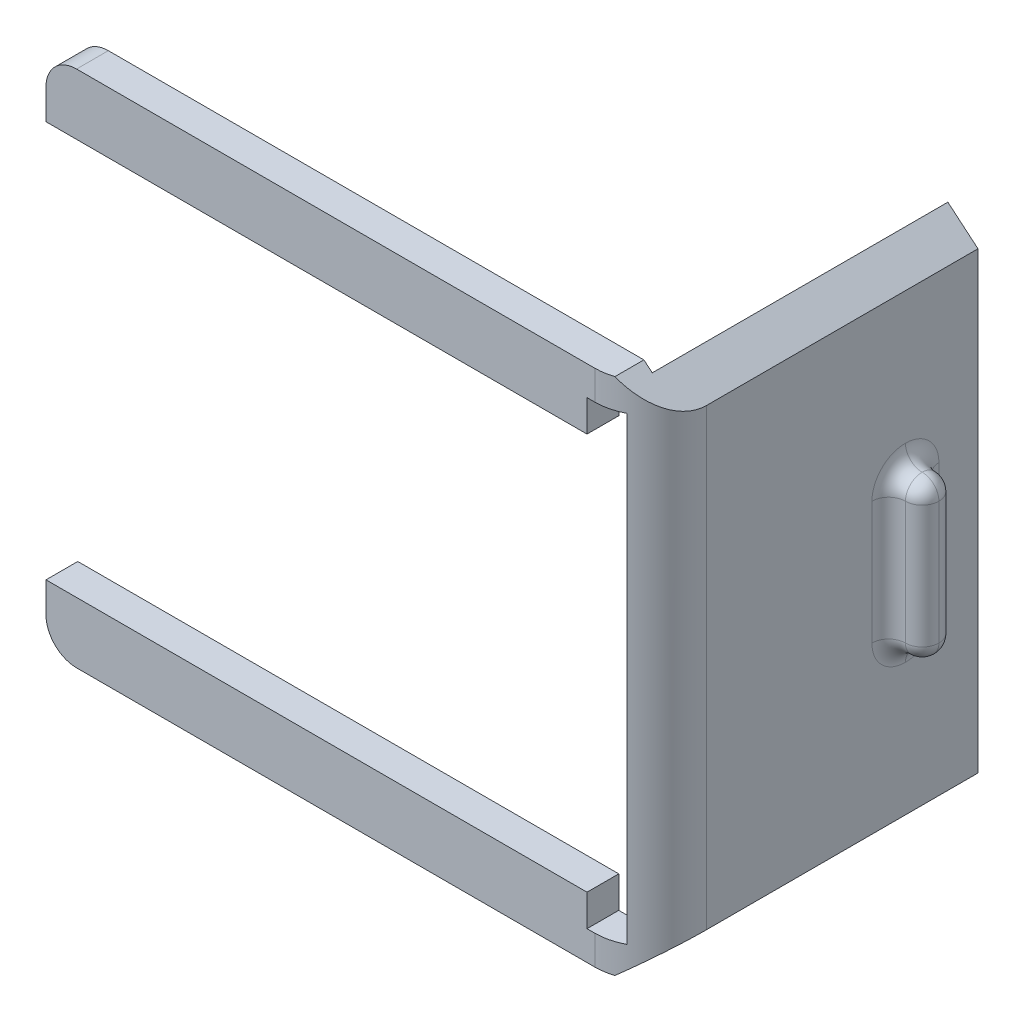
from build123d import *

# Parameters (mm, degrees)
BOSS_EXTRUDE1_DEPTH = 29.3184
BOSS_EXTRUDE2_DEPTH = 2.8448
FILLET1_R           = 5
SKETCH3_W           = 3
SKETCH3_H           = 14
BOSS_EXTRUDE3_DEPTH = 3
FILLET2_R           = 1.5
FILLET3_R           = 1.5


# Some blends are built 0.0001 mm under size
with BuildPart() as part:
    # Sketch1 → Boss-Extrude1 (new body)
    with BuildSketch(Plane.XY):
        Polygon((33.95, 21.346198616), (33.95, -23.846198616), (36.648979486, -21.581485925), (36.648979486, -1.25), (36.648979486, 19.081485925), align=None)
    extrude(amount=BOSS_EXTRUDE1_DEPTH)

    # Sketch2 → Boss-Extrude2 (add)
    with BuildSketch(Plane.XY.offset(29.3184)):
        with BuildLine():
            Line((33.95, -21.846198616), (33.95, -23.846198616))
            Line((33.95, -23.846198616), (33.200504516, -24.4751))
            Line((33.200504516, -24.4751), (-14.764, -24.4751))
            ThreePointArc((-14.764, -24.4751), (-16.701369719, -23.67255493), (-17.503709057, -21.7351))
            Line((-17.503709057, -21.7351), (-17.503709057, -19.0141))
            Line((-17.503709057, -19.0141), (30.95, -19.0141))
            Line((30.95, -19.0141), (30.95, -21.846198616))
            Line((30.95, -21.846198616), (33.95, -21.846198616))
        make_face()
        with BuildLine():
            Line((30.95, 19.346198616), (33.95, 19.346198616))
            Line((33.95, 19.346198616), (33.95, 21.346198616))
            Line((33.95, 21.346198616), (33.200504516, 21.9751))
            Line((33.200504516, 21.9751), (-14.764, 21.9751))
            ThreePointArc((-14.764, 21.9751), (-16.701369719, 21.17255493), (-17.503709057, 19.2351))
            Line((-17.503709057, 19.2351), (-17.503709057, 16.5141))
            Line((-17.503709057, 16.5141), (30.95, 16.5141))
            Line((30.95, 16.5141), (30.95, 19.346198616))
        make_face()
    extrude(amount=-BOSS_EXTRUDE2_DEPTH)

    # Fillet1
    # the kernel refuses this fillet: 5 mm, written as the material it takes off along each edge
    with BuildSketch(Plane(origin=(36.648979486, 31.581485925, 29.3184), x_dir=(0, 0, -1), z_dir=(0, -1, 0))) as fillet1_piece_1:
        with BuildLine():
            CenterArc((FILLET1_R, -FILLET1_R), FILLET1_R, 90, 90)
            Line((0, -FILLET1_R), (0, 0))
            Line((0, 0), (FILLET1_R, 0))
        make_face()
    extrude(amount=65.66297185, mode=Mode.SUBTRACT)

    # Sketch3 → Boss-Extrude3 (add)
    with BuildSketch(Plane(origin=(36.648979486, 0, 0), x_dir=(0, 0, -1), z_dir=(1, 0, 0))):
        with Locations((-6.5, -1.25)):
            Rectangle(SKETCH3_W, SKETCH3_H)
    extrude(amount=BOSS_EXTRUDE3_DEPTH)

    # Fillet2
    fillet2_edges = [part.edges().sort_by_distance(p)[0] for p in [
        (39.648979486, -1.25, 8),
        (39.648979486, -8.25, 6.5),
        (39.648979486, -1.25, 5),
        (39.648979486, 5.75, 6.5),
    ]]
    fillet(fillet2_edges, radius=FILLET2_R - 0.0001)  # a hair under: the kernel refuses the full size

    # Fillet3
    # the kernel refuses this fillet: 1.5 mm, written as the material it takes off along each edge
    with BuildSketch(Plane(origin=(39.648979486, -6.75, 6.5), x_dir=(0, -1, 0), z_dir=(0, 0, 1))) as fillet3_piece_1:
        with BuildLine():
            CenterArc((0.0001, -1.4999), 1.4999, 0, 90)
            Line((1.5, -1.4999), (1.5, 0))
            Line((1.5, 0), (0.0001, 0))
        make_face()
    revolve(axis=Axis((39.648979486, -6.75, 6.5), (1, 0, 0)), revolution_arc=90, mode=Mode.SUBTRACT)
    with BuildSketch(Plane(origin=(39.648979486, -6.75, 6.5), x_dir=(0, 0, 1), z_dir=(0, 1, 0))) as fillet3_piece_2:
        with BuildLine():
            CenterArc((0.0001, -1.4999), 1.4999, 0, 90)
            Line((1.5, -1.4999), (1.5, 0))
            Line((1.5, 0), (0.0001, 0))
        make_face()
    revolve(axis=Axis((39.648979486, -6.75, 6.5), (1, 0, 0)), revolution_arc=90, mode=Mode.SUBTRACT)
    with BuildSketch(Plane(origin=(39.648979486, 4.25, 6.5), x_dir=(0, 0, -1), z_dir=(0, -1, 0))) as fillet3_piece_3:
        with BuildLine():
            CenterArc((0.0001, -1.4999), 1.4999, 0, 90)
            Line((1.5, -1.4999), (1.5, 0))
            Line((1.5, 0), (0.0001, 0))
        make_face()
    revolve(axis=Axis((39.648979486, 4.25, 6.5), (1, 0, 0)), revolution_arc=90, mode=Mode.SUBTRACT)
    with BuildSketch(Plane(origin=(39.648979486, 4.25, 6.5), x_dir=(0, 1, 0), z_dir=(0, 0, -1))) as fillet3_piece_4:
        with BuildLine():
            CenterArc((0.0001, -1.4999), 1.4999, 0, 90)
            Line((1.5, -1.4999), (1.5, 0))
            Line((1.5, 0), (0.0001, 0))
        make_face()
    revolve(axis=Axis((39.648979486, 4.25, 6.5), (1, 0, 0)), revolution_arc=90, mode=Mode.SUBTRACT)
    with BuildSketch(Plane(origin=(36.648979486, 5.75, 8), x_dir=(0, -1, 0), z_dir=(1, 0, 0)), Plane(origin=(36.648979486, 5.75, 5), x_dir=(0, 0, 1), z_dir=(1, 0, 0))) as fillet3_piece_5:
        with BuildLine():
            CenterArc((FILLET3_R, FILLET3_R), FILLET3_R, 180, 90)
            Line((0, FILLET3_R), (-FILLET3_R * 0.02, FILLET3_R))
            Line((-FILLET3_R * 0.02, FILLET3_R), (-FILLET3_R * 0.02, -FILLET3_R * 0.02))
            Line((-FILLET3_R * 0.02, -FILLET3_R * 0.02), (FILLET3_R, -FILLET3_R * 0.02))
            Line((FILLET3_R, -FILLET3_R * 0.02), (FILLET3_R, 0))
        make_face()
    extrude(amount=3, mode=Mode.SUBTRACT)
    with BuildSketch(Plane(origin=(36.648979486, -8.25, 5), x_dir=(0, 0, 1), z_dir=(1, 0, 0)), Plane(origin=(36.648979486, -8.25, 8), x_dir=(0, 1, 0), z_dir=(1, 0, 0))) as fillet3_piece_6:
        with BuildLine():
            CenterArc((FILLET3_R, -FILLET3_R), FILLET3_R, 90, 90)
            Line((0, -FILLET3_R), (-FILLET3_R * 0.02, -FILLET3_R))
            Line((-FILLET3_R * 0.02, -FILLET3_R), (-FILLET3_R * 0.02, FILLET3_R * 0.02))
            Line((-FILLET3_R * 0.02, FILLET3_R * 0.02), (FILLET3_R, FILLET3_R * 0.02))
            Line((FILLET3_R, FILLET3_R * 0.02), (FILLET3_R, 0))
        make_face()
    extrude(amount=3, mode=Mode.SUBTRACT)
    fillet3_2_edges = [part.edges().sort_by_distance(p)[0] for p in [
        (36.648979486, -1.25, 8),
        (36.648979486, -1.25, 5),
    ]]
    fillet(fillet3_2_edges, radius=FILLET3_R)


solid = part.part
